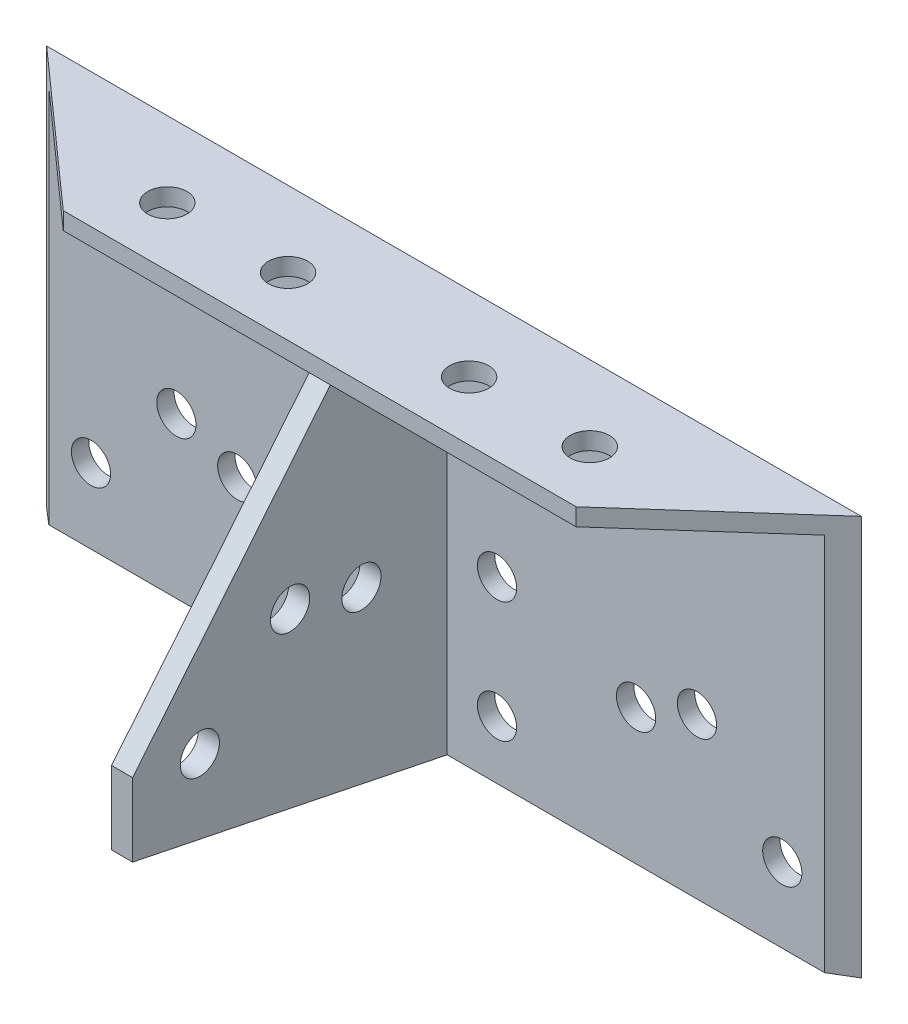
from build123d import *

# Parameters (mm, degrees)
SKETCH_1_W          = 540
SKETCH_1_H          = 265
SKETCH_1_R          = 13
EXTRUDE_619_DEPTH   = 11.5
SKETCH_2_W          = 540
SKETCH_2_H          = 11.5
EXTRUDE_1_DEPTH     = 77.5
CUT_EXTRUDE_1_DEPTH = 609.067430471
SKETCH_4_R          = 13
CUT_EXTRUDE_2_DEPTH = 609.067430471
SKETCH_5_W          = 14
SKETCH_5_H          = 253.5
EXTRUDE_2_DEPTH     = 208.5
SKETCH_6_R          = 13
CUT_EXTRUDE_3_DEPTH = 442.988687638
CUT_EXTRUDE_4_DEPTH = 442.988687638


with BuildPart() as part:
    # 草图1 → Extrude 619 (new body)
    with BuildSketch(Plane.XY):
        with Locations((270, 132.5)):
            Rectangle(SKETCH_1_W, SKETCH_1_H)
        with Locations((97.46594539, 108.46594539)):
            Circle(SKETCH_1_R, mode=Mode.SUBTRACT)
        with Locations((40.897402896, 51.897402896)):
            Circle(SKETCH_1_R, mode=Mode.SUBTRACT)
        with Locations((499.102597104, 51.897402896)):
            Circle(SKETCH_1_R, mode=Mode.SUBTRACT)
        with Locations((402.170987639, 92.261534081)):
            Circle(SKETCH_1_R, mode=Mode.SUBTRACT)
        with Locations((230, 121)):
            Circle(SKETCH_1_R, mode=Mode.SUBTRACT)
        with Locations((230, 41)):
            Circle(SKETCH_1_R, mode=Mode.SUBTRACT)
        with Locations((310, 41)):
            Circle(SKETCH_1_R, mode=Mode.SUBTRACT)
        with Locations((310, 121)):
            Circle(SKETCH_1_R, mode=Mode.SUBTRACT)
        with Locations((137.829012361, 92.261534081)):
            Circle(SKETCH_1_R, mode=Mode.SUBTRACT)
        with Locations((442.53405461, 108.46594539)):
            Circle(SKETCH_1_R, mode=Mode.SUBTRACT)
    extrude(amount=EXTRUDE_619_DEPTH)

    # 草图2 → 凸台-拉伸1 (add)
    with BuildSketch(Plane.XY.offset(11.5)):
        with Locations((270, 259.25)):
            Rectangle(SKETCH_2_W, SKETCH_2_H)
    extrude(amount=EXTRUDE_1_DEPTH)

    # 草图3 → 切除-拉伸1 (cut, through all)
    with BuildSketch(Plane(origin=(0, 265, 0), x_dir=(-1, 0, 0), z_dir=(0, 1, 0))):
        Polygon((0, 0), (-100, 89), (0, 89), align=None)
        Polygon((-540, 0), (-440, 89), (-540, 89), align=None)
    extrude(amount=-CUT_EXTRUDE_1_DEPTH, mode=Mode.SUBTRACT)

    # 草图4 → 切除-拉伸2 (cut, through all)
    with BuildSketch(Plane(origin=(0, 265, 0), x_dir=(-1, 0, 0), z_dir=(0, 1, 0))):
        with Locations((-210, 50)):
            Circle(SKETCH_4_R)
        with Locations((-130, 50)):
            Circle(SKETCH_4_R)
        with Locations((-410, 50)):
            Circle(SKETCH_4_R)
        with Locations((-330, 50)):
            Circle(SKETCH_4_R)
    extrude(amount=-CUT_EXTRUDE_2_DEPTH, mode=Mode.SUBTRACT)

    # 草图5 → 凸台-拉伸2 (add)
    with BuildSketch(Plane.XY.offset(11.5)):
        with Locations((270, 126.75)):
            Rectangle(SKETCH_5_W, SKETCH_5_H)
    extrude(amount=EXTRUDE_2_DEPTH)

    # 草图6 → 切除-拉伸3 (cut, through all)
    with BuildSketch(Plane(origin=(277, 0, 0), x_dir=(0, 0, -1), z_dir=(1, 0, 0))):
        with Locations((-115.676148082, 138.142814541)):
            Circle(SKETCH_6_R)
        with Locations((-175.462621788, 84.986652509)):
            Circle(SKETCH_6_R)
        with Locations((-68.377294113, 126.911974174)):
            Circle(SKETCH_6_R)
        Polygon((-89, 253.5), (-220, 93.5), (-220, 253.5), align=None)
        Polygon((-220, 45), (0, 0), (-220, 0), align=None)
    extrude(amount=-CUT_EXTRUDE_3_DEPTH, mode=Mode.SUBTRACT)

    # 草图7 → 切除-拉伸4 (cut, through all)
    with BuildSketch(Plane.ZY.offset(-277)):
        Polygon((0, 0), (11.5, 2.352272727), (11.5, 0), align=None)
    extrude(amount=-CUT_EXTRUDE_4_DEPTH, mode=Mode.SUBTRACT)


solid = part.part
